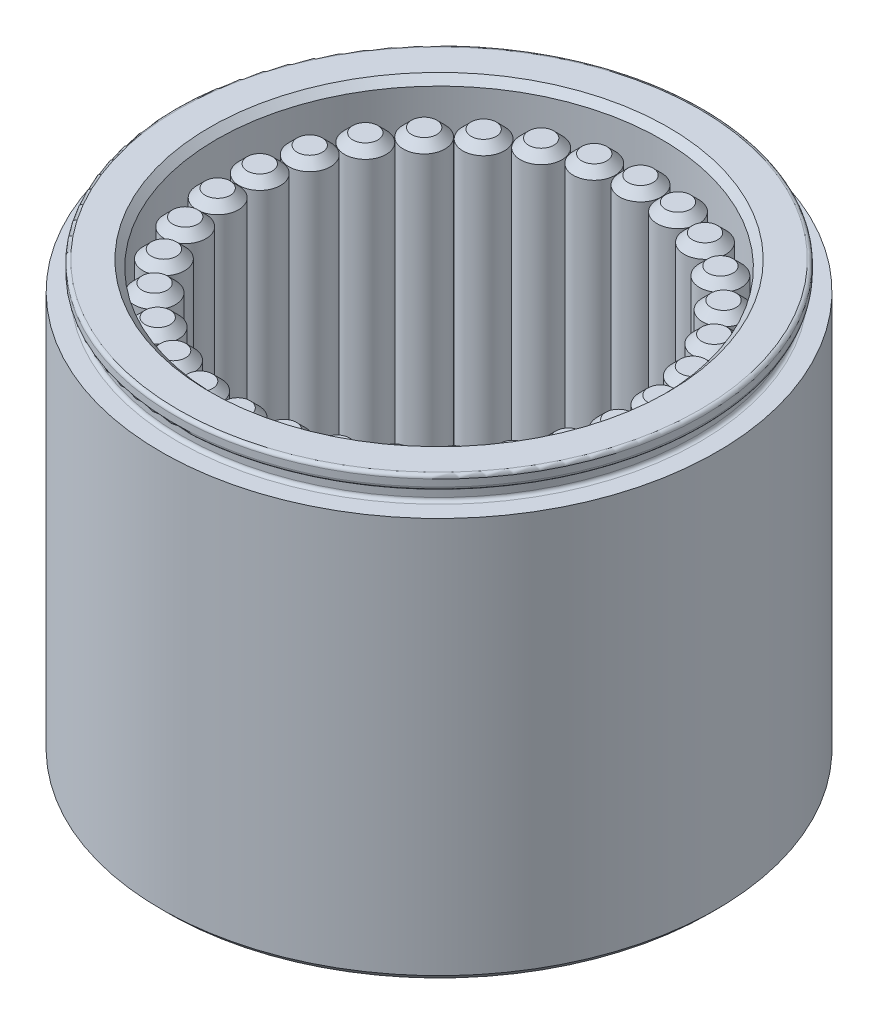
from build123d import *

# Parameters (mm, degrees)
CHAFL_N2_SIZE           = 0.5
REDONDEO3_R             = 0.25
CROQUIS2_R              = 1.5
SALIENTE_EXTRUIR1_DEPTH = 26
CHAFL_N1_SIZE           = 0.6
MATRIZC1_COUNT          = 30


with BuildPart() as part:
    # Croquis1 → Revolución1 (revolve)
    with BuildSketch(Plane.XY, mode=Mode.PRIVATE) as revoluci_n1_sk:
        with BuildLine():
            Line((0, 0), (20, 0))
            Line((20, 0), (20, 29))
            Line((20, 29), (18.5, 29))
            Line((18.5, 29), (18.5, 30))
            Line((18.5, 30), (19, 30))
            Line((19, 30), (19, 31))
            Line((19, 31), (16, 31))
            Line((16, 31), (16, 3.707106781))
            Line((16, 3.707106781), (16.353553391, 3.353553391))
            ThreePointArc((16.353553391, 3.353553391), (16.353553391, 2.646446609), (15.646446609, 2.646446609))
            Line((15.646446609, 2.646446609), (15.292893219, 3))
            Line((15.292893219, 3), (13, 3))
            Line((13, 3), (11.5, 4))
            Line((11.5, 4), (6, 4))
            Line((6, 4), (6, 3))
            Line((6, 3), (0, 3))
            Line((0, 3), (0, 0))
        make_face()
    revolve(revoluci_n1_sk.sketch.rotate(Axis((0, 3, 0), (0, -1, 0)), 180), axis=Axis((0, 3, 0), (0, -1, 0)))

    # Chaflán2
    chafl_n2_edges = [part.edges().sort_by_distance(p)[0] for p in [
        (20, 0, 0),
        (16, 31, 0),
    ]]
    chamfer(chafl_n2_edges, length=CHAFL_N2_SIZE)

    # Redondeo3
    redondeo3_edges = [part.edges().sort_by_distance(p)[0] for p in [
        (18.5, 29, 0),
        (18.5, 30, 0),
        (19, 30, 0),
        (19, 31, 0),
    ]]
    fillet(redondeo3_edges, radius=REDONDEO3_R - 0.0001)  # a hair under: the kernel refuses the full size


with BuildPart() as body_2:
    # Croquis2 → Saliente-Extruir1 (new body)
    with BuildSketch(Plane(origin=(0, 3, 0), x_dir=(1, 0, 0), z_dir=(0, 1, 0))):
        with Locations((0, 14.5)):
            Circle(CROQUIS2_R)
    extrude(amount=SALIENTE_EXTRUIR1_DEPTH)

    # Chaflán1
    chafl_n1_edges = [body_2.edges().sort_by_distance(p)[0] for p in [
        (-1.5, 3, -14.5),
        (-1.5, 29, -14.5),
    ]]
    chamfer(chafl_n1_edges, length=CHAFL_N1_SIZE)


with BuildPart() as matrizc1_1:
    # MatrizC1: pattern copy
    add(body_2.part.rotate(Axis((0, 0, 0), (0, 1, 0)), 1 * 360 / MATRIZC1_COUNT))


with BuildPart() as matrizc1_2:
    # MatrizC1: pattern copy
    add(body_2.part.rotate(Axis((0, 0, 0), (0, 1, 0)), 2 * 360 / MATRIZC1_COUNT))


with BuildPart() as matrizc1_3:
    # MatrizC1: pattern copy
    add(body_2.part.rotate(Axis((0, 0, 0), (0, 1, 0)), 3 * 360 / MATRIZC1_COUNT))


with BuildPart() as matrizc1_4:
    # MatrizC1: pattern copy
    add(body_2.part.rotate(Axis((0, 0, 0), (0, 1, 0)), 4 * 360 / MATRIZC1_COUNT))


with BuildPart() as matrizc1_5:
    # MatrizC1: pattern copy
    add(body_2.part.rotate(Axis((0, 0, 0), (0, 1, 0)), 5 * 360 / MATRIZC1_COUNT))


with BuildPart() as matrizc1_6:
    # MatrizC1: pattern copy
    add(body_2.part.rotate(Axis((0, 0, 0), (0, 1, 0)), 6 * 360 / MATRIZC1_COUNT))


with BuildPart() as matrizc1_7:
    # MatrizC1: pattern copy
    add(body_2.part.rotate(Axis((0, 0, 0), (0, 1, 0)), 7 * 360 / MATRIZC1_COUNT))


with BuildPart() as matrizc1_8:
    # MatrizC1: pattern copy
    add(body_2.part.rotate(Axis((0, 0, 0), (0, 1, 0)), 8 * 360 / MATRIZC1_COUNT))


with BuildPart() as matrizc1_9:
    # MatrizC1: pattern copy
    add(body_2.part.rotate(Axis((0, 0, 0), (0, 1, 0)), 9 * 360 / MATRIZC1_COUNT))


with BuildPart() as matrizc1_10:
    # MatrizC1: pattern copy
    add(body_2.part.rotate(Axis((0, 0, 0), (0, 1, 0)), 10 * 360 / MATRIZC1_COUNT))


with BuildPart() as matrizc1_11:
    # MatrizC1: pattern copy
    add(body_2.part.rotate(Axis((0, 0, 0), (0, 1, 0)), 11 * 360 / MATRIZC1_COUNT))


with BuildPart() as matrizc1_12:
    # MatrizC1: pattern copy
    add(body_2.part.rotate(Axis((0, 0, 0), (0, 1, 0)), 12 * 360 / MATRIZC1_COUNT))


with BuildPart() as matrizc1_13:
    # MatrizC1: pattern copy
    add(body_2.part.rotate(Axis((0, 0, 0), (0, 1, 0)), 13 * 360 / MATRIZC1_COUNT))


with BuildPart() as matrizc1_14:
    # MatrizC1: pattern copy
    add(body_2.part.rotate(Axis((0, 0, 0), (0, 1, 0)), 14 * 360 / MATRIZC1_COUNT))


with BuildPart() as matrizc1_15:
    # MatrizC1: pattern copy
    add(body_2.part.rotate(Axis((0, 0, 0), (0, 1, 0)), 15 * 360 / MATRIZC1_COUNT))


with BuildPart() as matrizc1_16:
    # MatrizC1: pattern copy
    add(body_2.part.rotate(Axis((0, 0, 0), (0, 1, 0)), 16 * 360 / MATRIZC1_COUNT))


with BuildPart() as matrizc1_17:
    # MatrizC1: pattern copy
    add(body_2.part.rotate(Axis((0, 0, 0), (0, 1, 0)), 17 * 360 / MATRIZC1_COUNT))


with BuildPart() as matrizc1_18:
    # MatrizC1: pattern copy
    add(body_2.part.rotate(Axis((0, 0, 0), (0, 1, 0)), 18 * 360 / MATRIZC1_COUNT))


with BuildPart() as matrizc1_19:
    # MatrizC1: pattern copy
    add(body_2.part.rotate(Axis((0, 0, 0), (0, 1, 0)), 19 * 360 / MATRIZC1_COUNT))


with BuildPart() as matrizc1_20:
    # MatrizC1: pattern copy
    add(body_2.part.rotate(Axis((0, 0, 0), (0, 1, 0)), 20 * 360 / MATRIZC1_COUNT))


with BuildPart() as matrizc1_21:
    # MatrizC1: pattern copy
    add(body_2.part.rotate(Axis((0, 0, 0), (0, 1, 0)), 21 * 360 / MATRIZC1_COUNT))


with BuildPart() as matrizc1_22:
    # MatrizC1: pattern copy
    add(body_2.part.rotate(Axis((0, 0, 0), (0, 1, 0)), 22 * 360 / MATRIZC1_COUNT))


with BuildPart() as matrizc1_23:
    # MatrizC1: pattern copy
    add(body_2.part.rotate(Axis((0, 0, 0), (0, 1, 0)), 23 * 360 / MATRIZC1_COUNT))


with BuildPart() as matrizc1_24:
    # MatrizC1: pattern copy
    add(body_2.part.rotate(Axis((0, 0, 0), (0, 1, 0)), 24 * 360 / MATRIZC1_COUNT))


with BuildPart() as matrizc1_25:
    # MatrizC1: pattern copy
    add(body_2.part.rotate(Axis((0, 0, 0), (0, 1, 0)), 25 * 360 / MATRIZC1_COUNT))


with BuildPart() as matrizc1_26:
    # MatrizC1: pattern copy
    add(body_2.part.rotate(Axis((0, 0, 0), (0, 1, 0)), 26 * 360 / MATRIZC1_COUNT))


with BuildPart() as matrizc1_27:
    # MatrizC1: pattern copy
    add(body_2.part.rotate(Axis((0, 0, 0), (0, 1, 0)), 27 * 360 / MATRIZC1_COUNT))


with BuildPart() as matrizc1_28:
    # MatrizC1: pattern copy
    add(body_2.part.rotate(Axis((0, 0, 0), (0, 1, 0)), 28 * 360 / MATRIZC1_COUNT))


with BuildPart() as matrizc1_29:
    # MatrizC1: pattern copy
    add(body_2.part.rotate(Axis((0, 0, 0), (0, 1, 0)), 29 * 360 / MATRIZC1_COUNT))


solid = Compound([part.part, body_2.part, matrizc1_1.part, matrizc1_2.part, matrizc1_3.part, matrizc1_4.part, matrizc1_5.part, matrizc1_6.part, matrizc1_7.part, matrizc1_8.part, matrizc1_9.part, matrizc1_10.part, matrizc1_11.part, matrizc1_12.part, matrizc1_13.part, matrizc1_14.part, matrizc1_15.part, matrizc1_16.part, matrizc1_17.part, matrizc1_18.part, matrizc1_19.part, matrizc1_20.part, matrizc1_21.part, matrizc1_22.part, matrizc1_23.part, matrizc1_24.part, matrizc1_25.part, matrizc1_26.part, matrizc1_27.part, matrizc1_28.part, matrizc1_29.part])
